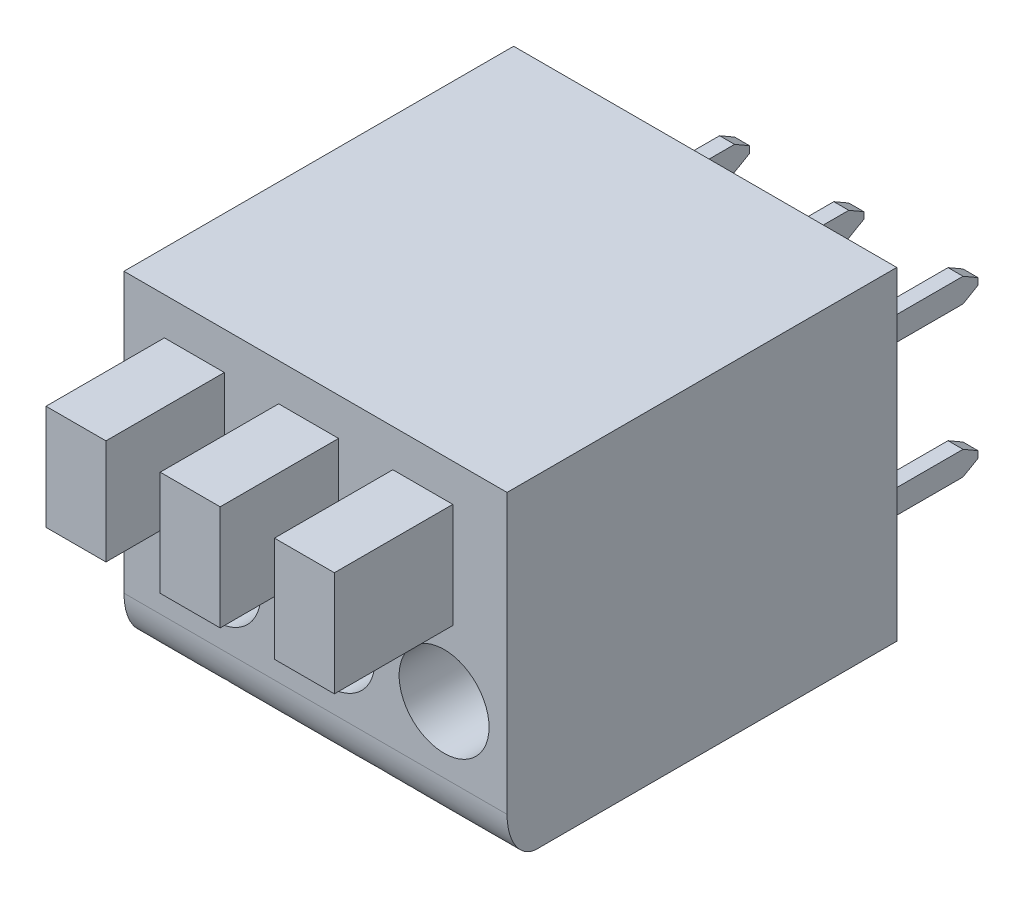
from build123d import *
from OCP.BRepFilletAPI import BRepFilletAPI_MakeChamfer

# Parameters (mm, degrees)
SKETCH_1_W                          = 12.78
SKETCH_1_H                          = 10.8
EXTRUDE_1_DEPTH                     = 13
FILLET_1_SIZE                       = 1
FILLET_1_SIZE_2                     = 1.5
SKETCH_2_W                          = 2
SKETCH_2_H                          = 3.5
EXTRUDE_2_DEPTH                     = 3.95
SKETCH_3_R                          = 1.5
CUT_EXTRUDE_1_DEPTH                 = 3.95
SKETCH_4_W                          = 0.5
SKETCH_4_H                          = 0.8
EXTRUDE_3_DEPTH                     = 3.5
CHAMFER_1_SIZE                      = 0.5
CHAMFER_1_SIZE2                     = 0.288675135
PATTERN_LINEAR_2_COUNT              = 3
PATTERN_LINEAR_2_PITCH              = 3.81
CHAMFER_1_OF_PATTERN_LINEAR_2_SIZE  = 0.5
CHAMFER_1_OF_PATTERN_LINEAR_2_SIZE2 = 0.288675135


with BuildPart() as part:
    # Эскиз1 → Бобышка-Вытянуть1 (new body)
    with BuildSketch(Plane.XY):
        Rectangle(SKETCH_1_W, SKETCH_1_H)
    extrude(amount=EXTRUDE_1_DEPTH)

    # Скругление1
    # an asymmetric fillet: 1.5, 1 mm, written as the material it takes off along each edge
    with BuildSketch(Plane(origin=(-10.14, -5.4, 13), x_dir=(0, 0, -1), z_dir=(1, 0, 0))) as fillet_1_piece_1:
        with BuildLine():
            Bezier((FILLET_1_SIZE, 0), (0, 0), (0, FILLET_1_SIZE_2), weights=[1, 0.707106781, 1])
            Line((0, FILLET_1_SIZE_2), (0, 0))
            Line((0, 0), (FILLET_1_SIZE, 0))
        make_face()
    extrude(amount=20.28, mode=Mode.SUBTRACT)

    # Эскиз2 → Бобышка-Вытянуть2 (add)
    with BuildSketch(Plane.XY.offset(13)):
        with Locations((3.58, 2.4)):
            Rectangle(SKETCH_2_W, SKETCH_2_H)
    extrude_2 = extrude(amount=EXTRUDE_2_DEPTH)

    # Эскиз3 → Вырез-Вытянуть1 (cut)
    with BuildSketch(Plane.XY.offset(13)):
        with Locations((4.29, -1.686021073)):
            Circle(SKETCH_3_R)
    cut_extrude_1 = extrude(amount=-CUT_EXTRUDE_1_DEPTH, mode=Mode.SUBTRACT)

    # Эскиз4 → Бобышка-Вытянуть3 (add)
    with BuildSketch(Plane(origin=(0, 0, 0), x_dir=(-1, 0, 0), z_dir=(0, 0, -1))):
        with Locations((-5.35, 2.85)):
            Rectangle(SKETCH_4_W, SKETCH_4_H)
        with Locations((-5.35, -2.15)):
            Rectangle(SKETCH_4_W, SKETCH_4_H)
    extrude_3 = extrude(amount=EXTRUDE_3_DEPTH)

    # Фаска1: one chamfer whose edges measure the first distance from different faces: ONE call of the kernel's chamfer builder (chamfer() names one face for all edges)
    chamfer_1_edges_1 = [part.edges().sort_by_distance(p)[0] for p in [
        (5.35, 3.25, -3.5),
    ]]
    chamfer_1_side_1 = [part.faces().sort_by_distance(p)[0] for p in [
        (5.35, 3.25, -1.75),
    ]]
    chamfer_1_edges_2 = [part.edges().sort_by_distance(p)[0] for p in [
        (5.35, 2.45, -3.5),
    ]]
    chamfer_1_side_2 = [part.faces().sort_by_distance(p)[0] for p in [
        (5.35, 2.45, -1.75),
    ]]
    chamfer_1_edges_3 = [part.edges().sort_by_distance(p)[0] for p in [
        (5.35, -2.55, -3.5),
    ]]
    chamfer_1_side_3 = [part.faces().sort_by_distance(p)[0] for p in [
        (5.35, -2.55, -1.75),
    ]]
    chamfer_1_edges_4 = [part.edges().sort_by_distance(p)[0] for p in [
        (5.35, -1.75, -3.5),
    ]]
    chamfer_1_side_4 = [part.faces().sort_by_distance(p)[0] for p in [
        (5.35, -1.75, -1.75),
    ]]
    chamfer_1 = BRepFilletAPI_MakeChamfer(part.part.solid().wrapped)
    for e in chamfer_1_edges_1:
        chamfer_1.Add(CHAMFER_1_SIZE, CHAMFER_1_SIZE2, e.wrapped, chamfer_1_side_1[0].wrapped)  # the first distance lies on this face
    for e in chamfer_1_edges_2:
        chamfer_1.Add(CHAMFER_1_SIZE, CHAMFER_1_SIZE2, e.wrapped, chamfer_1_side_2[0].wrapped)  # the first distance lies on this face
    for e in chamfer_1_edges_3:
        chamfer_1.Add(CHAMFER_1_SIZE, CHAMFER_1_SIZE2, e.wrapped, chamfer_1_side_3[0].wrapped)  # the first distance lies on this face
    for e in chamfer_1_edges_4:
        chamfer_1.Add(CHAMFER_1_SIZE, CHAMFER_1_SIZE2, e.wrapped, chamfer_1_side_4[0].wrapped)  # the first distance lies on this face
    add(Compound.cast(chamfer_1.Shape()), mode=Mode.REPLACE)

    # Линейный массив2: Бобышка-Вытянуть2, Вырез-Вытянуть1, Бобышка-Вытянуть3 ×3
    with Locations(*[(-i * PATTERN_LINEAR_2_PITCH, 0, 0) for i in range(1, PATTERN_LINEAR_2_COUNT)]):
        add(extrude_2)
        add(cut_extrude_1, mode=Mode.SUBTRACT)
        add(extrude_3)

    # Фаска1 of Линейный массив2: one chamfer whose edges measure the first distance from different faces: ONE call of the kernel's chamfer builder (chamfer() names one face for all edges)
    chamfer_1_of_pattern_linear_2_edges_1 = [part.edges().sort_by_distance(p)[0] for p in [
        (1.54, 3.25, -3.5),
    ]]
    chamfer_1_of_pattern_linear_2_side_1 = [part.faces().sort_by_distance(p)[0] for p in [
        (1.54, 3.25, -1.75),
    ]]
    chamfer_1_of_pattern_linear_2_edges_2 = [part.edges().sort_by_distance(p)[0] for p in [
        (1.54, 2.45, -3.5),
    ]]
    chamfer_1_of_pattern_linear_2_side_2 = [part.faces().sort_by_distance(p)[0] for p in [
        (1.54, 2.45, -1.75),
    ]]
    chamfer_1_of_pattern_linear_2_edges_3 = [part.edges().sort_by_distance(p)[0] for p in [
        (1.54, -2.55, -3.5),
    ]]
    chamfer_1_of_pattern_linear_2_side_3 = [part.faces().sort_by_distance(p)[0] for p in [
        (1.54, -2.55, -1.75),
    ]]
    chamfer_1_of_pattern_linear_2_edges_4 = [part.edges().sort_by_distance(p)[0] for p in [
        (1.54, -1.75, -3.5),
    ]]
    chamfer_1_of_pattern_linear_2_side_4 = [part.faces().sort_by_distance(p)[0] for p in [
        (1.54, -1.75, -1.75),
    ]]
    chamfer_1_of_pattern_linear_2_edges_5 = [part.edges().sort_by_distance(p)[0] for p in [
        (-2.27, 3.25, -3.5),
    ]]
    chamfer_1_of_pattern_linear_2_side_5 = [part.faces().sort_by_distance(p)[0] for p in [
        (-2.27, 3.25, -1.75),
    ]]
    chamfer_1_of_pattern_linear_2_edges_6 = [part.edges().sort_by_distance(p)[0] for p in [
        (-2.27, 2.45, -3.5),
    ]]
    chamfer_1_of_pattern_linear_2_side_6 = [part.faces().sort_by_distance(p)[0] for p in [
        (-2.27, 2.45, -1.75),
    ]]
    chamfer_1_of_pattern_linear_2_edges_7 = [part.edges().sort_by_distance(p)[0] for p in [
        (-2.27, -2.55, -3.5),
    ]]
    chamfer_1_of_pattern_linear_2_side_7 = [part.faces().sort_by_distance(p)[0] for p in [
        (-2.27, -2.55, -1.75),
    ]]
    chamfer_1_of_pattern_linear_2_edges_8 = [part.edges().sort_by_distance(p)[0] for p in [
        (-2.27, -1.75, -3.5),
    ]]
    chamfer_1_of_pattern_linear_2_side_8 = [part.faces().sort_by_distance(p)[0] for p in [
        (-2.27, -1.75, -1.75),
    ]]
    chamfer_1_of_pattern_linear_2 = BRepFilletAPI_MakeChamfer(part.part.solid().wrapped)
    for e in chamfer_1_of_pattern_linear_2_edges_1:
        chamfer_1_of_pattern_linear_2.Add(CHAMFER_1_OF_PATTERN_LINEAR_2_SIZE, CHAMFER_1_OF_PATTERN_LINEAR_2_SIZE2, e.wrapped, chamfer_1_of_pattern_linear_2_side_1[0].wrapped)  # the first distance lies on this face
    for e in chamfer_1_of_pattern_linear_2_edges_2:
        chamfer_1_of_pattern_linear_2.Add(CHAMFER_1_OF_PATTERN_LINEAR_2_SIZE, CHAMFER_1_OF_PATTERN_LINEAR_2_SIZE2, e.wrapped, chamfer_1_of_pattern_linear_2_side_2[0].wrapped)  # the first distance lies on this face
    for e in chamfer_1_of_pattern_linear_2_edges_3:
        chamfer_1_of_pattern_linear_2.Add(CHAMFER_1_OF_PATTERN_LINEAR_2_SIZE, CHAMFER_1_OF_PATTERN_LINEAR_2_SIZE2, e.wrapped, chamfer_1_of_pattern_linear_2_side_3[0].wrapped)  # the first distance lies on this face
    for e in chamfer_1_of_pattern_linear_2_edges_4:
        chamfer_1_of_pattern_linear_2.Add(CHAMFER_1_OF_PATTERN_LINEAR_2_SIZE, CHAMFER_1_OF_PATTERN_LINEAR_2_SIZE2, e.wrapped, chamfer_1_of_pattern_linear_2_side_4[0].wrapped)  # the first distance lies on this face
    for e in chamfer_1_of_pattern_linear_2_edges_5:
        chamfer_1_of_pattern_linear_2.Add(CHAMFER_1_OF_PATTERN_LINEAR_2_SIZE, CHAMFER_1_OF_PATTERN_LINEAR_2_SIZE2, e.wrapped, chamfer_1_of_pattern_linear_2_side_5[0].wrapped)  # the first distance lies on this face
    for e in chamfer_1_of_pattern_linear_2_edges_6:
        chamfer_1_of_pattern_linear_2.Add(CHAMFER_1_OF_PATTERN_LINEAR_2_SIZE, CHAMFER_1_OF_PATTERN_LINEAR_2_SIZE2, e.wrapped, chamfer_1_of_pattern_linear_2_side_6[0].wrapped)  # the first distance lies on this face
    for e in chamfer_1_of_pattern_linear_2_edges_7:
        chamfer_1_of_pattern_linear_2.Add(CHAMFER_1_OF_PATTERN_LINEAR_2_SIZE, CHAMFER_1_OF_PATTERN_LINEAR_2_SIZE2, e.wrapped, chamfer_1_of_pattern_linear_2_side_7[0].wrapped)  # the first distance lies on this face
    for e in chamfer_1_of_pattern_linear_2_edges_8:
        chamfer_1_of_pattern_linear_2.Add(CHAMFER_1_OF_PATTERN_LINEAR_2_SIZE, CHAMFER_1_OF_PATTERN_LINEAR_2_SIZE2, e.wrapped, chamfer_1_of_pattern_linear_2_side_8[0].wrapped)  # the first distance lies on this face
    add(Compound.cast(chamfer_1_of_pattern_linear_2.Shape()), mode=Mode.REPLACE)


solid = part.part
